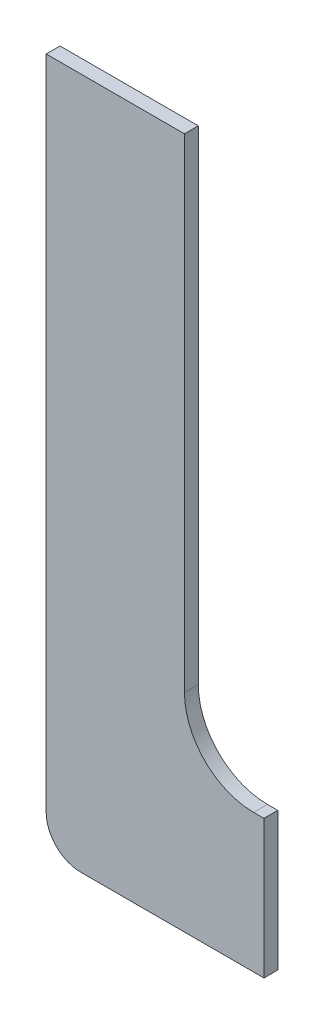
from build123d import *

# Parameters (mm, degrees)
EXTRUDE_1_DEPTH = 2
FILLET_1_R      = 10
FILLET_2_R      = 5


with BuildPart() as part:
    # 草图1 → 凸台-拉伸1 (new body)
    with BuildSketch(Plane.XY):
        Polygon((0, 0), (-31.5, 0), (-31.5, 100), (-11.5, 100), (-11.5, 20), (0, 20), align=None)
    extrude(amount=EXTRUDE_1_DEPTH)

    # 圆角1
    fillet_1_edges = [part.edges().sort_by_distance(p)[0] for p in [
        (-11.5, 20, 1),
    ]]
    fillet(fillet_1_edges, radius=FILLET_1_R)

    # 圆角2
    fillet_2_edges = [part.edges().sort_by_distance(p)[0] for p in [
        (-31.5, 0, 1),
    ]]
    fillet(fillet_2_edges, radius=FILLET_2_R)


solid = part.part
